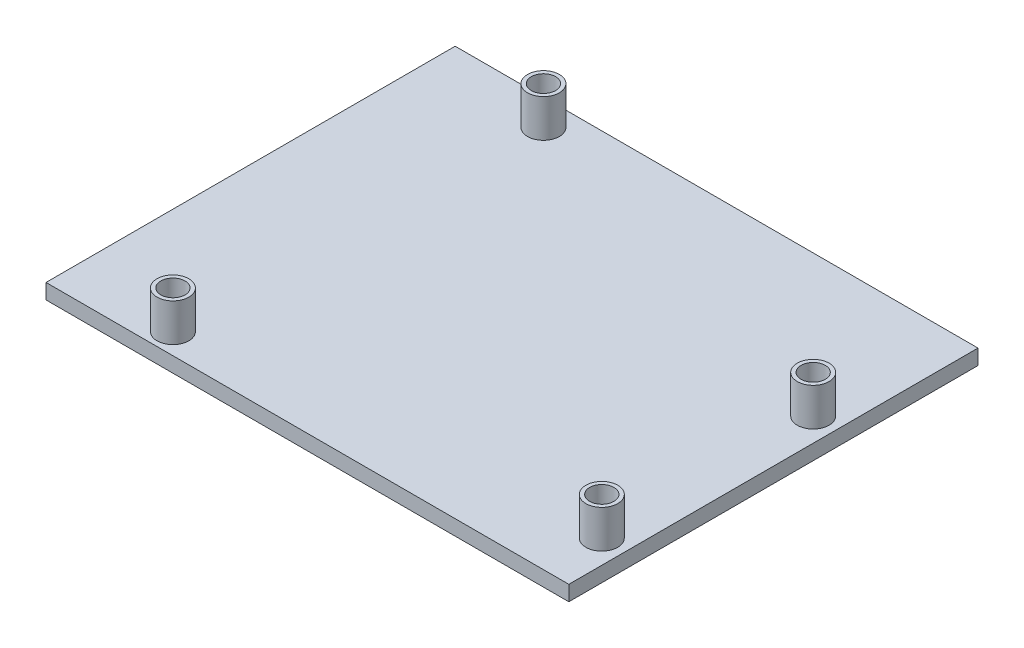
from build123d import *

# Parameters (mm, degrees)
SKETCH1_W           = 69
SKETCH1_H           = 54
BOSS_EXTRUDE1_DEPTH = 2
SKETCH2_R           = 2.1
SKETCH2_R_2         = 1.6
BOSS_EXTRUDE2_DEPTH = 5


with BuildPart() as part:
    # Sketch1 → Boss-Extrude1 (new body)
    with BuildSketch(Plane(origin=(0, 0, 0), x_dir=(1, 0, 0), z_dir=(0, 1, 0))):
        Rectangle(SKETCH1_W, SKETCH1_H)
    extrude(amount=BOSS_EXTRUDE1_DEPTH)

    # Sketch2 → Boss-Extrude2 (add)
    # profile 1 of 4: a face of its own
    with BuildSketch(Plane(origin=(0, 2, 0), x_dir=(1, 0, 0), z_dir=(0, 1, 0))):
        with Locations((-19.4, 23.55)):
            Circle(SKETCH2_R)
        with Locations((-19.4, 23.55)):
            Circle(SKETCH2_R_2, mode=Mode.SUBTRACT)
    # profile 2 of 4: a face of its own
    with BuildSketch(Plane(origin=(0, 2, 0), x_dir=(1, 0, 0), z_dir=(0, 1, 0))):
        with Locations((31.4, 8.35)):
            Circle(SKETCH2_R)
        with Locations((31.4, 8.35)):
            Circle(SKETCH2_R_2, mode=Mode.SUBTRACT)
    # profile 3 of 4: a face of its own
    with BuildSketch(Plane(origin=(0, 2, 0), x_dir=(1, 0, 0), z_dir=(0, 1, 0))):
        with Locations((31.4, -19.55)):
            Circle(SKETCH2_R)
        with Locations((31.4, -19.55)):
            Circle(SKETCH2_R_2, mode=Mode.SUBTRACT)
    # profile 4 of 4: a face of its own
    with BuildSketch(Plane(origin=(0, 2, 0), x_dir=(1, 0, 0), z_dir=(0, 1, 0))):
        with Locations((-20.5, -24.25)):
            Circle(SKETCH2_R)
        with Locations((-20.5, -24.25)):
            Circle(SKETCH2_R_2, mode=Mode.SUBTRACT)
    extrude(amount=BOSS_EXTRUDE2_DEPTH)


solid = part.part
